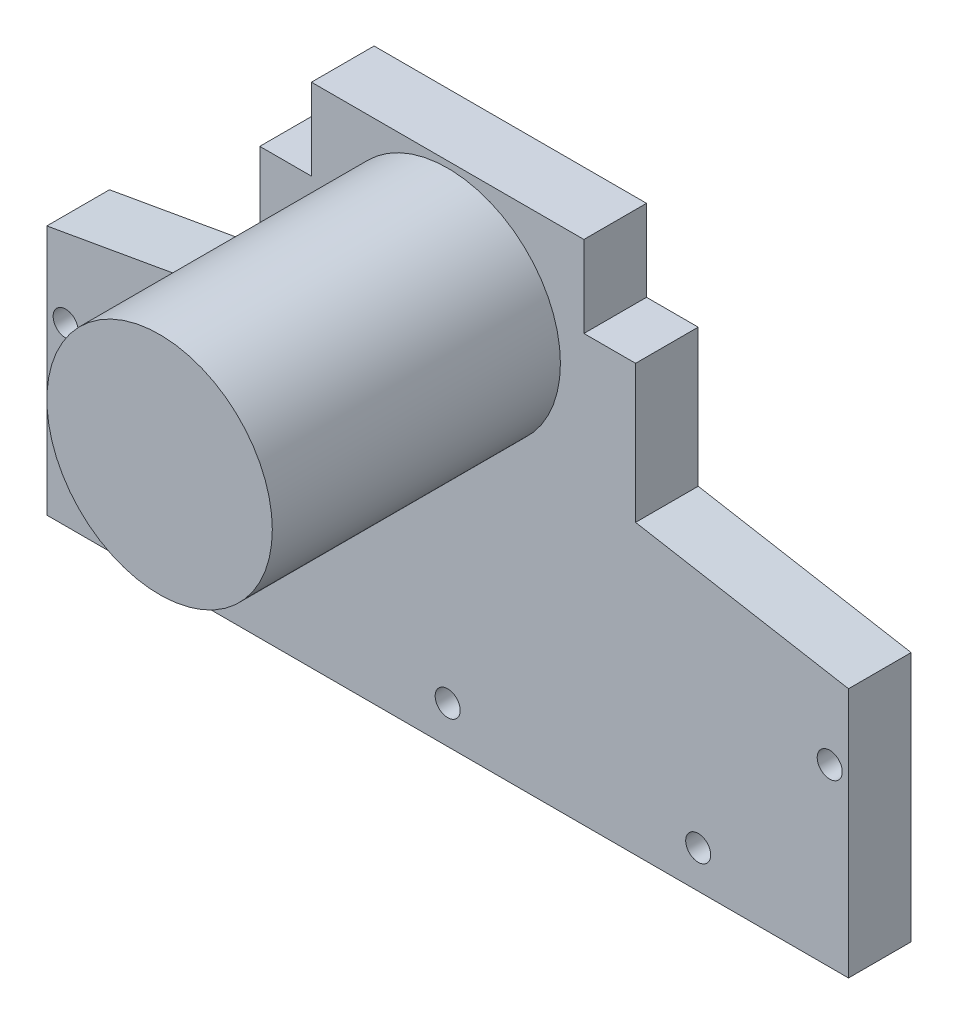
from build123d import *

# Parameters (mm, degrees)
BOSS_EXTRUDE1_DEPTH = 5
SKETCH2_R           = 1
CUT_EXTRUDE1_DEPTH  = 5
SKETCH3_R           = 9
BOSS_EXTRUDE2_DEPTH = 23


with BuildPart() as part:
    # Sketch1 → Boss-Extrude1 (new body)
    with BuildSketch(Plane.XY):
        Polygon((-32, 20), (-32, 0), (32, 0), (32, 20), (15, 23), (15, 34), (10.875, 34), (10.875, 40.5), (-10.875, 40.5), (-10.875, 34), (-15, 34), (-15, 23), align=None)
    extrude(amount=BOSS_EXTRUDE1_DEPTH)

    # Sketch2 → Cut-Extrude1 (cut)
    with BuildSketch(Plane.XY.offset(5)):
        with Locations((20, 3)):
            Circle(SKETCH2_R)
        with Locations((0, 3)):
            Circle(SKETCH2_R)
        with Locations((-20, 3)):
            Circle(SKETCH2_R)
        with Locations((-30.5, 14)):
            Circle(SKETCH2_R)
        with Locations((30.5, 14)):
            Circle(SKETCH2_R)
    extrude(amount=-CUT_EXTRUDE1_DEPTH, mode=Mode.SUBTRACT)

    # Sketch3 → Boss-Extrude2 (add)
    with BuildSketch(Plane.XY.offset(5)):
        with Locations((0, 31)):
            Circle(SKETCH3_R)
    extrude(amount=BOSS_EXTRUDE2_DEPTH)


solid = part.part
